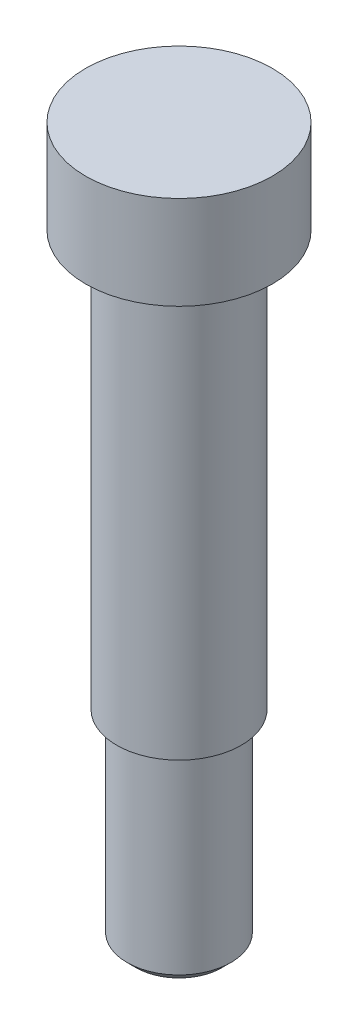
from build123d import *


# Read off the part's stored shape, not the designer's step: M5 机械螺纹 螺柱1
with BuildPart() as part:
    # 草图1 → 旋转1 (revolve)
    with BuildSketch(Plane.XY, mode=Mode.PRIVATE) as revolve_1_sk:
        Polygon((0, 0), (0, 34.25), (4.5, 34.25), (4.5, 29.75), (3, 29.75), (3, 9.75), (2.8, 9.75), (2.8, 0), align=None)
    revolve(revolve_1_sk.sketch.rotate(Axis((0, 0, 0), (0, 1, 0)), 90), axis=Axis((0, 0, 0), (0, 1, 0)))

    # M5 机械螺纹 螺柱1 outline → M5 机械螺纹 螺柱1 (revolve, cut)
    with BuildSketch(Plane.XY):
        Polygon((2.8, 9.75), (2.5, 9.75), (2.5, 0.433), (2.067, 0), (2.8, 0), align=None)
    revolve(axis=Axis((0, 0, 0), (0, 1, 0)), mode=Mode.SUBTRACT)


solid = part.part
